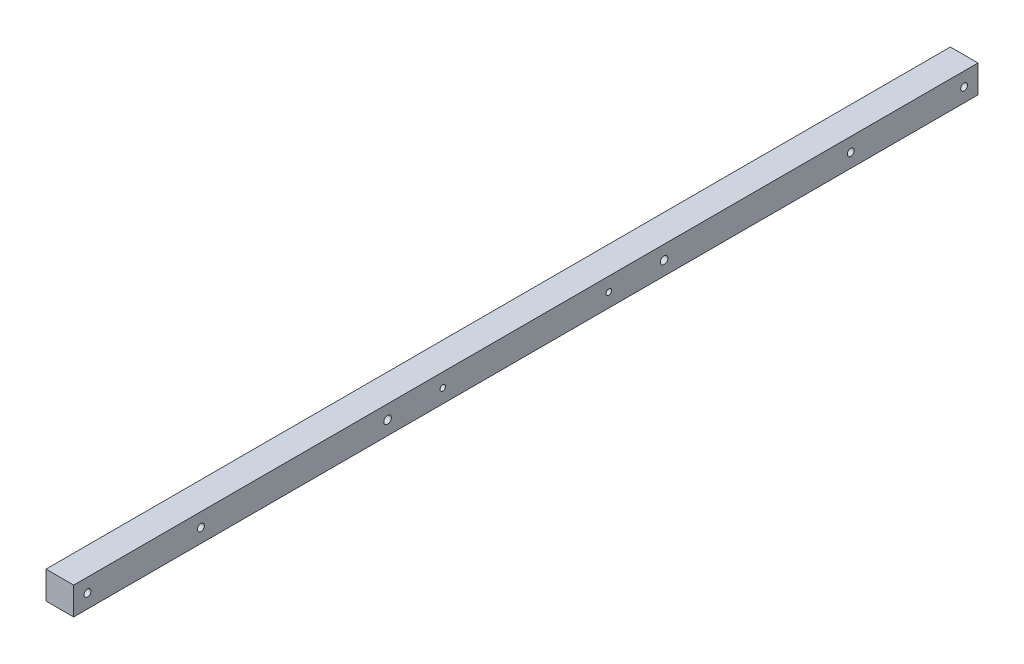
from build123d import *

# Parameters (mm, degrees)
SKETCH1_W                   = 25.4
SKETCH1_H                   = 25.4
BOSS_EXTRUDE1_DEPTH         = 830.58
SKETCH2_R                   = 3.175
SKETCH2_R_2                 = 3.5
CUT_EXTRUDE4_DEPTH          = 832.065332209
F_1_4_20_TAPPED_HOLE1_D     = 5.1054
F_1_4_20_TAPPED_HOLE1_DEPTH = 19.05
F_1_4_20_TAPPED_HOLE1_TIP   = 1.533816902


with BuildPart() as part:
    # Sketch1 → Boss-Extrude1 (new body)
    with BuildSketch(Plane.XY):
        Rectangle(SKETCH1_W, SKETCH1_H)
    extrude(amount=BOSS_EXTRUDE1_DEPTH)

    # Sketch2 → Cut-Extrude4 (cut, through all)
    with BuildSketch(Plane(origin=(-12.7, 0, 0), x_dir=(0, 0, -1), z_dir=(1, 0, 0))):
        with Locations((-12.7, 0)):
            Circle(SKETCH2_R)
        with Locations((-116.84, 0)):
            Circle(SKETCH2_R)
        with Locations((-288.29, 0)):
            Circle(SKETCH2_R_2)
    cut_extrude4 = extrude(amount=CUT_EXTRUDE4_DEPTH, mode=Mode.SUBTRACT)

    # Mirror1: Cut-Extrude4 across plane
    add(cut_extrude4.mirror(Plane(origin=(0, 0, 415.29), x_dir=(1, 0, 0), z_dir=(0, 0, -1))), mode=Mode.SUBTRACT)

    # 1/4-20 Tapped Hole1
    with Locations(Plane(origin=(12.7, 0, 0), x_dir=(0, 0, -1), z_dir=(1, 0, 0))):
        with Locations((-339.09, 0), (-491.49, 0)):
            Hole(F_1_4_20_TAPPED_HOLE1_D / 2, depth=F_1_4_20_TAPPED_HOLE1_DEPTH)
            with Locations((0, 0, -(F_1_4_20_TAPPED_HOLE1_DEPTH + F_1_4_20_TAPPED_HOLE1_TIP / 2))):  # 118° drill point
                Cone(0, F_1_4_20_TAPPED_HOLE1_D / 2, F_1_4_20_TAPPED_HOLE1_TIP, mode=Mode.SUBTRACT)


solid = part.part
